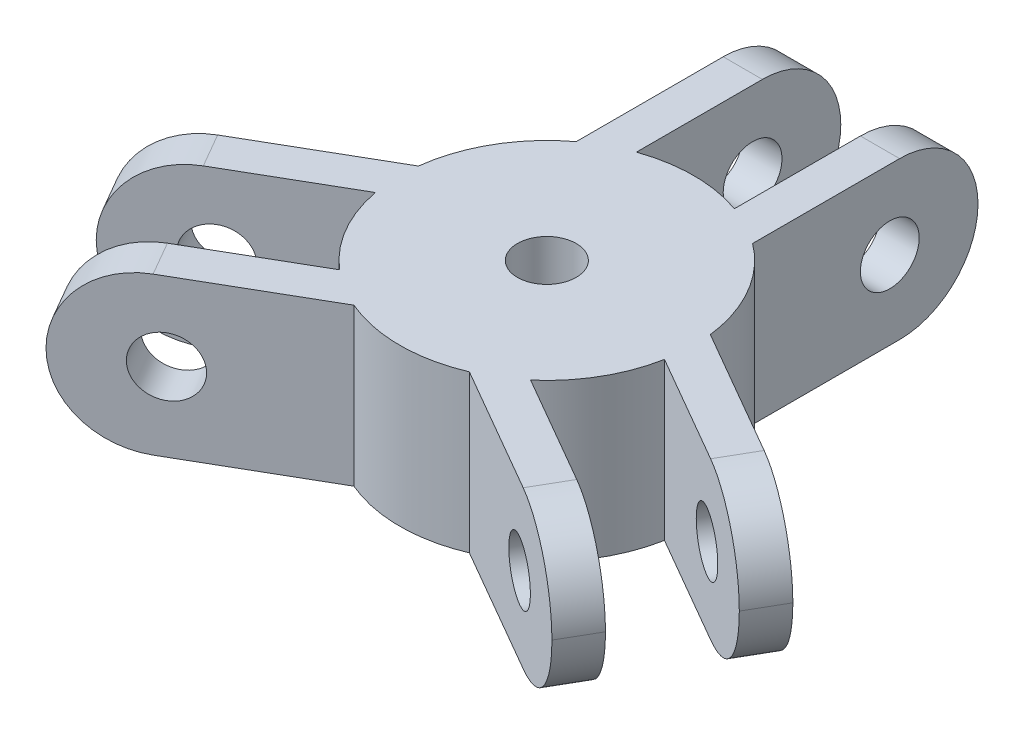
from build123d import *

# Parameters (mm, degrees)
BOSS_EXTRUDE1_DEPTH = 8
CUT_EXTRUDE1_REACH  = 32.136
SKETCH2_R           = 1.5
CUT_EXTRUDE2_REACH  = 31.156
SKETCH3_R           = 1.5
CUT_EXTRUDE3_REACH  = 28.908
SKETCH4_R           = 1.5
SKETCH5_R           = 4.5
CUT_EXTRUDE4_DEPTH  = 5
SKETCH6_R           = 1.5
CUT_EXTRUDE5_DEPTH  = 26.183317902
FILLET1_R           = 4


with BuildPart() as part:
    # Sketch1 → Boss-Extrude1 (new body)
    with BuildSketch(Plane(origin=(0, 0, 0), x_dir=(1, 0, 0), z_dir=(0, 1, 0))):
        with BuildLine():
            ThreePointArc((-2.946152423, -6.897114317), (-3.95544326, -6.372163574), (-4.873724357, -5.700597415))
            Line((-4.873724357, -5.700597415), (-13.905444566, -10.915063509))
            Line((-13.905444566, -10.915063509), (-12.905444566, -12.647114317))
            Line((-12.905444566, -12.647114317), (-2.946152423, -6.897114317))
        make_face()
        with BuildLine():
            Line((-16.405444566, -6.584936491), (-7.373724357, -1.370470396))
            ThreePointArc((-7.373724357, -1.370470396), (-7.496177162, -0.23943256), (-7.446152423, 0.897114317))
            Line((-7.446152423, 0.897114317), (-17.405444566, -4.852885683))
            Line((-17.405444566, -4.852885683), (-16.405444566, -6.584936491))
        make_face()
        Polygon((-2.5, 1.443375673), (-2.5, 0), (0, 0), (-1.25, 2.165063509), align=None)
        Polygon((1.25, -2.165063509), (0, 0), (-1.25, -2.165063509), (0, -2.886751346), align=None)
        with BuildLine():
            Line((-7.446152423, 0.897114317), (-4.5, 2.598076211))
            Line((-4.5, 2.598076211), (-4.5, 6))
            ThreePointArc((-4.5, 6), (-6.495190528, 3.75), (-7.446152423, 0.897114317))
        make_face()
        with BuildLine():
            Line((0, -5.196152423), (-2.946152423, -6.897114317))
            ThreePointArc((-2.946152423, -6.897114317), (0, -7.5), (2.946152423, -6.897114317))
            Line((2.946152423, -6.897114317), (0, -5.196152423))
        make_face()
        Polygon((1.25, 2.165063509), (0, 0), (2.5, 0), (2.5, 1.443375673), align=None)
        with BuildLine():
            ThreePointArc((7.446152423, 0.897114317), (6.495190528, 3.75), (4.5, 6))
            Line((4.5, 6), (4.5, 2.598076211))
            Line((4.5, 2.598076211), (7.446152423, 0.897114317))
        make_face()
        with BuildLine():
            ThreePointArc((7.5, 0), (7.468364368, -0.688137822), (7.373724357, -1.370470396))
            Line((7.373724357, -1.370470396), (16.405444566, -6.584936491))
            Line((16.405444566, -6.584936491), (17.405444566, -4.852885683))
            Line((17.405444566, -4.852885683), (7.446152423, 0.897114317))
            ThreePointArc((7.446152423, 0.897114317), (7.486526002, 0.449364457), (7.5, 0))
        make_face()
        with BuildLine():
            ThreePointArc((4.873724357, -5.700597415), (3.95544326, -6.372163574), (2.946152423, -6.897114317))
            Line((2.946152423, -6.897114317), (12.905444566, -12.647114317))
            Line((12.905444566, -12.647114317), (13.905444566, -10.915063509))
            Line((13.905444566, -10.915063509), (4.873724357, -5.700597415))
        make_face()
        with BuildLine():
            Line((2.5, 17.5), (2.5, 7.071067812))
            ThreePointArc((2.5, 7.071067812), (3.540733902, 6.611596134), (4.5, 6))
            Line((4.5, 6), (4.5, 17.5))
            Line((4.5, 17.5), (2.5, 17.5))
        make_face()
        with BuildLine():
            Line((-4.5, 17.5), (-4.5, 6))
            ThreePointArc((-4.5, 6), (-3.540733902, 6.611596134), (-2.5, 7.071067812))
            Line((-2.5, 7.071067812), (-2.5, 17.5))
            Line((-2.5, 17.5), (-4.5, 17.5))
        make_face()
        with BuildLine():
            Line((-2.5, 0), (-4.5, 0))
            Line((-4.5, 0), (-4.5, 0.288675135))
            Line((-4.5, 0.288675135), (-7.373724357, -1.370470396))
            ThreePointArc((-7.373724357, -1.370470396), (-6.495190528, -3.75), (-4.873724357, -5.700597415))
            Line((-4.873724357, -5.700597415), (-2, -4.041451884))
            Line((-2, -4.041451884), (-2.25, -3.897114317))
            Line((-2.25, -3.897114317), (-1.25, -2.165063509))
            Line((-1.25, -2.165063509), (0, 0))
            Line((0, 0), (-2.5, 0))
        make_face()
        Polygon((-4.5, 0.288675135), (-4.5, 0), (-2.5, 0), (-2.5, 1.443375673), align=None)
        with BuildLine():
            Line((-7.373724357, -1.370470396), (-4.5, 0.288675135))
            Line((-4.5, 0.288675135), (-4.5, 2.598076211))
            Line((-4.5, 2.598076211), (-7.446152423, 0.897114317))
            ThreePointArc((-7.446152423, 0.897114317), (-7.496177162, -0.23943256), (-7.373724357, -1.370470396))
        make_face()
        Polygon((-4.5, 2.598076211), (-4.5, 0.288675135), (-2.5, 1.443375673), (-2.5, 3.75277675), align=None)
        with BuildLine():
            Line((-4.5, 6), (-4.5, 2.598076211))
            Line((-4.5, 2.598076211), (-2.5, 3.75277675))
            Line((-2.5, 3.75277675), (-2.5, 7.071067812))
            ThreePointArc((-2.5, 7.071067812), (-3.540733902, 6.611596134), (-4.5, 6))
        make_face()
        Polygon((-2.5, 3.75277675), (-2.5, 1.443375673), (-1.25, 2.165063509), (-2.25, 3.897114317), align=None)
        with BuildLine():
            Line((2.5, 0), (0, 0))
            Line((0, 0), (1.25, -2.165063509))
            Line((1.25, -2.165063509), (2.25, -3.897114317))
            Line((2.25, -3.897114317), (2, -4.041451884))
            Line((2, -4.041451884), (4.873724357, -5.700597415))
            ThreePointArc((4.873724357, -5.700597415), (6.495190528, -3.75), (7.373724357, -1.370470396))
            Line((7.373724357, -1.370470396), (4.5, 0.288675135))
            Line((4.5, 0.288675135), (4.5, 0))
            Line((4.5, 0), (2.5, 0))
        make_face()
        with BuildLine():
            Line((-1.25, 2.165063509), (0, 0))
            Line((0, 0), (1.25, 2.165063509))
            Line((1.25, 2.165063509), (2.25, 3.897114317))
            Line((2.25, 3.897114317), (2.5, 3.75277675))
            Line((2.5, 3.75277675), (2.5, 7.071067812))
            ThreePointArc((2.5, 7.071067812), (0, 7.5), (-2.5, 7.071067812))
            Line((-2.5, 7.071067812), (-2.5, 3.75277675))
            Line((-2.5, 3.75277675), (-2.25, 3.897114317))
            Line((-2.25, 3.897114317), (-1.25, 2.165063509))
        make_face()
        with BuildLine():
            Line((-2, -4.041451884), (-4.873724357, -5.700597415))
            ThreePointArc((-4.873724357, -5.700597415), (-3.95544326, -6.372163574), (-2.946152423, -6.897114317))
            Line((-2.946152423, -6.897114317), (0, -5.196152423))
            Line((0, -5.196152423), (-2, -4.041451884))
        make_face()
        Polygon((2.5, 1.443375673), (2.5, 0), (4.5, 0), (4.5, 0.288675135), align=None)
        Polygon((2.25, -3.897114317), (1.25, -2.165063509), (0, -2.886751346), (2, -4.041451884), align=None)
        Polygon((2.25, 3.897114317), (1.25, 2.165063509), (2.5, 1.443375673), (2.5, 3.75277675), align=None)
        Polygon((0, -2.886751346), (-1.25, -2.165063509), (-2.25, -3.897114317), (-2, -4.041451884), align=None)
        Polygon((0, -2.886751346), (-2, -4.041451884), (0, -5.196152423), (2, -4.041451884), align=None)
        Polygon((2.5, 3.75277675), (2.5, 1.443375673), (4.5, 0.288675135), (4.5, 2.598076211), align=None)
        with BuildLine():
            ThreePointArc((4.5, 6), (3.540733902, 6.611596134), (2.5, 7.071067812))
            Line((2.5, 7.071067812), (2.5, 3.75277675))
            Line((2.5, 3.75277675), (4.5, 2.598076211))
            Line((4.5, 2.598076211), (4.5, 6))
        make_face()
        with BuildLine():
            Line((2, -4.041451884), (0, -5.196152423))
            Line((0, -5.196152423), (2.946152423, -6.897114317))
            ThreePointArc((2.946152423, -6.897114317), (3.95544326, -6.372163574), (4.873724357, -5.700597415))
            Line((4.873724357, -5.700597415), (2, -4.041451884))
        make_face()
        with BuildLine():
            Line((4.5, 2.598076211), (4.5, 0.288675135))
            Line((4.5, 0.288675135), (7.373724357, -1.370470396))
            ThreePointArc((7.373724357, -1.370470396), (7.468364368, -0.688137822), (7.5, 0))
            ThreePointArc((7.5, 0), (7.486526002, 0.449364457), (7.446152423, 0.897114317))
            Line((7.446152423, 0.897114317), (4.5, 2.598076211))
        make_face()
    extrude(amount=BOSS_EXTRUDE1_DEPTH)

    # Cut-Extrude1: up to this face of the body (flat: up to its plane)
    cut_extrude1_end = Plane(part.part.faces().sort_by_distance((-12.425798494, 4, 1.977885683))[0])
    # Sketch2 → Cut-Extrude1 (cut, up to the picked face)
    with BuildSketch(Plane(origin=(2.25, 0, 3.897114317), x_dir=(0.8660254037844364, 0, -0.5000000000000039), z_dir=(0.5000000000000039, 0, 0.8660254037844364)), mode=Mode.PRIVATE) as cut_extrude1_sk1:
        with Locations((-13, 4)):
            Circle(SKETCH2_R)
    cut_extrude1_tool1 = split(extrude(cut_extrude1_sk1.sketch, amount=-CUT_EXTRUDE1_REACH, mode=Mode.PRIVATE), bisect_by=cut_extrude1_end, keep=Keep.BOTH, mode=Mode.PRIVATE)
    add(cut_extrude1_tool1.solids().sort_by(Axis((-9.00833, 4, 10.397114), (-0.5000000000000039, 0, -0.8660254037844364)))[0], mode=Mode.SUBTRACT)

    # Cut-Extrude2: up to this face of the body (flat: up to its plane)
    cut_extrude2_end = Plane(part.part.faces().sort_by_distance((4.5, 4, -11.75))[0])
    # Sketch3 → Cut-Extrude2 (cut, up to the picked face)
    with BuildSketch(Plane.ZY.offset(4.5), mode=Mode.PRIVATE) as cut_extrude2_sk1:
        with Locations((-13, 4)):
            Circle(SKETCH3_R)
    cut_extrude2_tool1 = split(extrude(cut_extrude2_sk1.sketch, amount=-CUT_EXTRUDE2_REACH, mode=Mode.PRIVATE), bisect_by=cut_extrude2_end, keep=Keep.BOTH, mode=Mode.PRIVATE)
    add(cut_extrude2_tool1.solids().sort_by(Axis((-4.5, 4, -13), (1, 0, 0)))[0], mode=Mode.SUBTRACT)

    # Cut-Extrude3: up to this face of the body (flat: up to its plane)
    cut_extrude3_end = Plane(part.part.faces().sort_by_distance((7.925798494, 4, 9.772114317))[0])
    # Sketch4 → Cut-Extrude3 (cut, up to the picked face)
    with BuildSketch(Plane(origin=(2.25, 0, -3.897114317), x_dir=(-0.8660254037844363, 0, -0.5000000000000042), z_dir=(0.5000000000000041, 0, -0.8660254037844362)), mode=Mode.PRIVATE) as cut_extrude3_sk1:
        with Locations((-13, 4)):
            Circle(SKETCH4_R)
    cut_extrude3_tool1 = split(extrude(cut_extrude3_sk1.sketch, amount=-CUT_EXTRUDE3_REACH, mode=Mode.PRIVATE), bisect_by=cut_extrude3_end, keep=Keep.BOTH, mode=Mode.PRIVATE)
    add(cut_extrude3_tool1.solids().sort_by(Axis((13.50833, 4, 2.602886), (-0.5000000000000041, 0, 0.8660254037844362)))[0], mode=Mode.SUBTRACT)

    # Sketch5 → Cut-Extrude4 (cut)
    with BuildSketch(Plane.XZ):
        with Locations(Location((0, 0, 0), (0, 0, 270))):
            Circle(SKETCH5_R)
    extrude(amount=-CUT_EXTRUDE4_DEPTH, mode=Mode.SUBTRACT)

    # Sketch6 → Cut-Extrude5 (cut, through all)
    with BuildSketch(Plane.XZ.offset(-5)):
        with Locations(Location((0, 0, 0), (0, 0, 270))):
            Circle(SKETCH6_R)
    extrude(amount=-CUT_EXTRUDE5_DEPTH, mode=Mode.SUBTRACT)

    # Fillet1
    fillet1_edges = [part.edges().sort_by_distance(p)[0] for p in [
        (-13.405444566, 0, 11.781088913),
        (-13.405444566, 8, 11.781088913),
        (-16.905444566, 0, 5.718911087),
        (-16.905444566, 8, 5.718911087),
        (-3.5, 0, -17.5),
        (-3.5, 8, -17.5),
        (3.5, 0, -17.5),
        (3.5, 8, -17.5),
        (13.405444566, 0, 11.781088913),
        (13.405444566, 8, 11.781088913),
        (16.905444566, 0, 5.718911087),
        (16.905444566, 8, 5.718911087),
    ]]
    fillet(fillet1_edges, radius=FILLET1_R - 0.0001)  # a hair under: the kernel refuses the full size


solid = part.part
